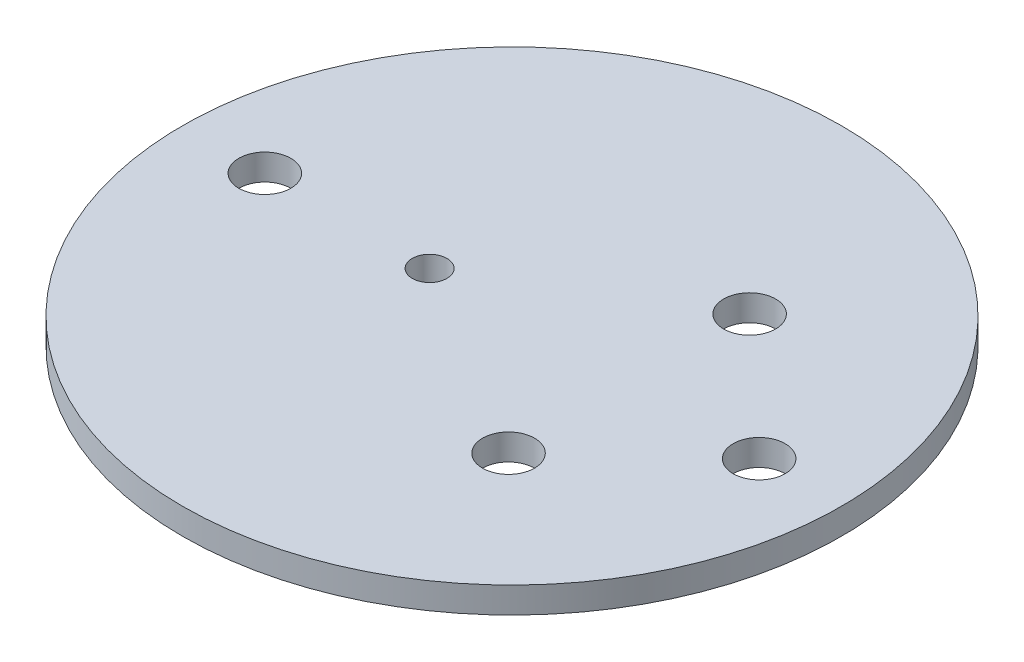
from build123d import *

# Parameters (mm, degrees)
SKETCH1_R           = 38
SKETCH1_R_2         = 3
SKETCH1_R_3         = 2
BOSS_EXTRUDE1_DEPTH = 3


with BuildPart() as part:
    # Sketch1 → Boss-Extrude1 (new body)
    with BuildSketch(Plane(origin=(0, 0, 0), x_dir=(1, 0, 0), z_dir=(0, 1, 0))):
        Circle(SKETCH1_R)
        with BuildLine():
            ThreePointArc((16.5, -13.9), (11.378679656, -16.021320344), (13.5, -10.9))
            ThreePointArc((13.5, -10.9), (15.621320344, -11.778679656), (16.5, -13.9))
        make_face(mode=Mode.SUBTRACT)
        with Locations((-28.5, 0)):
            Circle(SKETCH1_R_2, mode=Mode.SUBTRACT)
        with Locations((-9.5, 0)):
            Circle(SKETCH1_R_3, mode=Mode.SUBTRACT)
        with BuildLine():
            ThreePointArc((16.5, 13.9), (15.621320344, 11.778679656), (13.5, 10.9))
            ThreePointArc((13.5, 10.9), (11.378679656, 16.021320344), (16.5, 13.9))
        make_face(mode=Mode.SUBTRACT)
        with Locations((28.5, 0)):
            Circle(SKETCH1_R_2, mode=Mode.SUBTRACT)
    extrude(amount=-BOSS_EXTRUDE1_DEPTH)


solid = part.part
